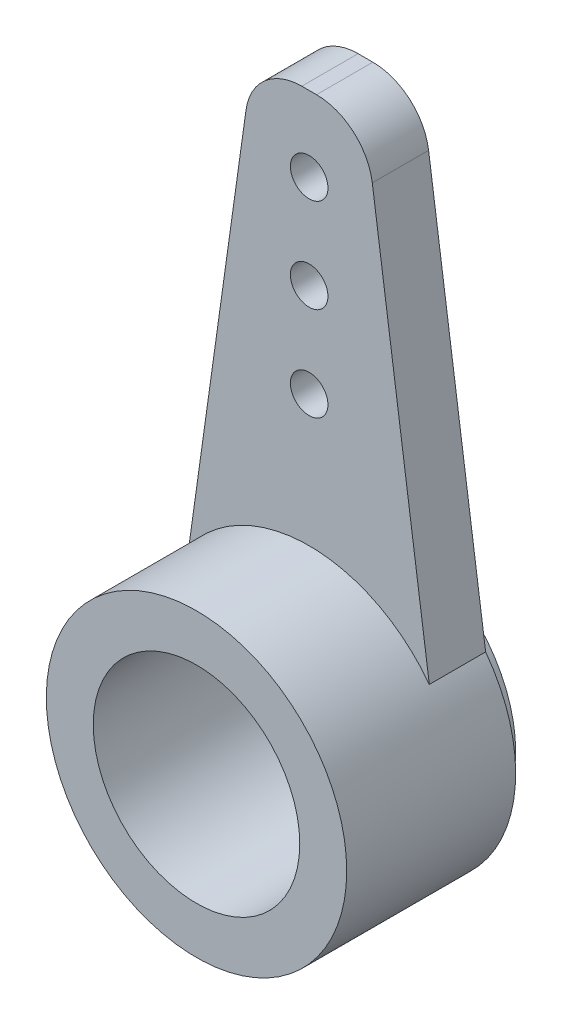
from build123d import *
from build123d.topology import SkipClean

# Parameters (mm, degrees)
SKETCH1_R           = 0.5
SKETCH1_R_2         = 1.5
BOSS_EXTRUDE3_DEPTH = 1.5
SKETCH2_R           = 4
BOSS_EXTRUDE4_DEPTH = 3
SKETCH3_R           = 3.5
SKETCH3_R_2         = 3.25
BOSS_EXTRUDE5_DEPTH = 0.5
SKETCH4_R           = 2.75
CUT_EXTRUDE1_DEPTH  = 4


with BuildPart() as part:
    # Sketch1 → Boss-Extrude3 (new body)
    with BuildSketch(Plane.XY):
        with BuildLine():
            Line((-3.2, 2.4), (-1.681423136, 13.208694151))
            ThreePointArc((-1.681423136, 13.208694151), (-1.180125332, 14.132042673), (-0.196011829, 14.5))
            Line((-0.196011829, 14.5), (0.196011829, 14.5))
            ThreePointArc((0.196011829, 14.5), (1.180125332, 14.132042673), (1.681423136, 13.208694151))
            Line((1.681423136, 13.208694151), (3.2, 2.4))
            ThreePointArc((3.2, 2.4), (0, -4), (-3.2, 2.4))
        make_face()
        with Locations((0, 10)):
            Circle(SKETCH1_R, mode=Mode.SUBTRACT)
        with Locations((0, 12.5)):
            Circle(SKETCH1_R, mode=Mode.SUBTRACT)
        with Locations((0, 7.5)):
            Circle(SKETCH1_R, mode=Mode.SUBTRACT)
        Circle(SKETCH1_R_2, mode=Mode.SUBTRACT)
    extrude(amount=BOSS_EXTRUDE3_DEPTH)

    # Sketch2 → Boss-Extrude4 (add)
    with SkipClean():  # the faces are left unmerged after this step: merging them gives an invalid solid
        with BuildSketch(Plane.XY.offset(1.5)):
            Circle(SKETCH2_R)
        extrude(amount=BOSS_EXTRUDE4_DEPTH)
    add(part.part.scale(1), mode=Mode.REPLACE)  # the faces are merged on a copy

    # Sketch3 → Boss-Extrude5 (add)
    with BuildSketch(Plane(origin=(0, 0, 0), x_dir=(-1, 0, 0), z_dir=(0, 0, -1))):
        Circle(SKETCH3_R)
        Circle(SKETCH3_R_2, mode=Mode.SUBTRACT)
    extrude(amount=BOSS_EXTRUDE5_DEPTH)

    # Sketch4 → Cut-Extrude1 (cut)
    with BuildSketch(Plane.XY.offset(4.5)):
        Circle(SKETCH4_R)
    extrude(amount=-CUT_EXTRUDE1_DEPTH, mode=Mode.SUBTRACT)


solid = part.part
